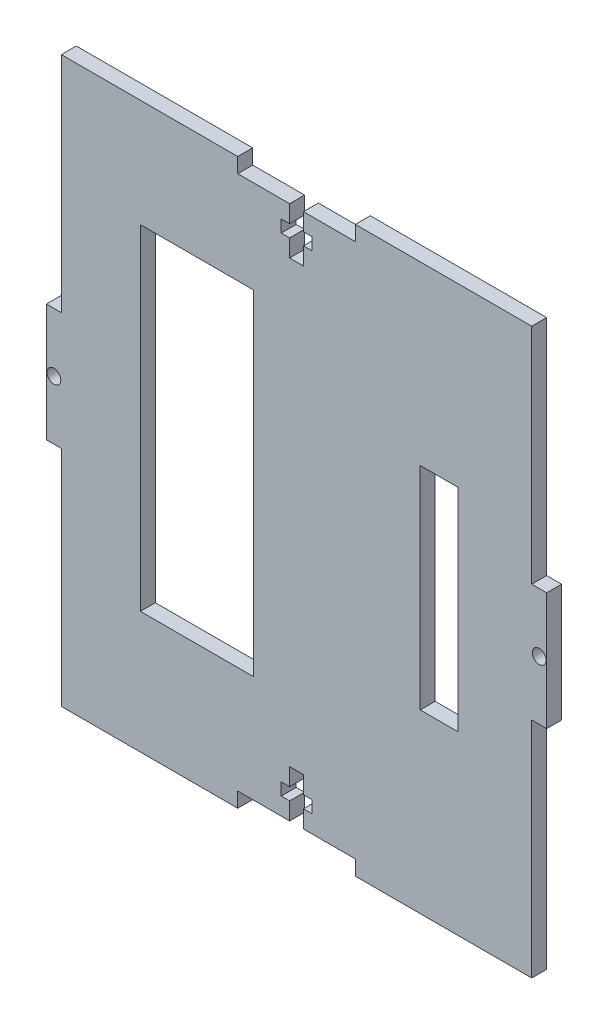
from build123d import *

# Parameters (mm, degrees)
SKETCH1_R           = 1.47
BOSS_EXTRUDE1_DEPTH = 1.5875
SKETCH3_W           = 8
SKETCH3_H           = 45
CUT_EXTRUDE1_DEPTH  = 81.235037546
SKETCH4_W           = 24
SKETCH4_H           = 71.2
CUT_EXTRUDE2_DEPTH  = 81.235037546


with BuildPart() as part:
    # Sketch1 → Boss-Extrude1 (new, symmetric)
    with BuildSketch(Plane.XY):
        Polygon((-12.5, 60), (-50, 60), (-50, 12.5), (-53.175, 12.5), (-53.175, -12.5), (-50, -12.5), (-50, -60), (-12.5, -60), (-12.5, -56.825), (-1.47, -56.825), (-1.47, -53.125), (-3.25, -53.125), (-3.25, -50.525), (-1.47, -50.525), (-1.47, -46.825), (1.47, -46.825), (1.47, -50.525), (3.25, -50.525), (3.25, -53.125), (1.47, -53.125), (1.47, -56.825), (12.5, -56.825), (12.5, -60), (50, -60), (50, -12.5), (53.175, -12.5), (53.175, 12.5), (50, 12.5), (50, 60), (12.5, 60), (12.5, 56.825), (1.47, 56.825), (1.47, 53.125), (3.25, 53.125), (3.25, 50.525), (1.47, 50.525), (1.47, 46.825), (-1.47, 46.825), (-1.47, 50.525), (-3.25, 50.525), (-3.25, 53.125), (-1.47, 53.125), (-1.47, 56.825), (-12.5, 56.825), align=None)
        with Locations((51.5875, 0)):
            Circle(SKETCH1_R, mode=Mode.SUBTRACT)
        with Locations((-51.5875, 0)):
            Circle(SKETCH1_R, mode=Mode.SUBTRACT)
    extrude(amount=BOSS_EXTRUDE1_DEPTH, both=True)

    # Sketch3 → Cut-Extrude1 (cut, through all)
    with BuildSketch(Plane(origin=(0, 0, -1.5875), x_dir=(-1, 0, 0), z_dir=(0, 0, -1))):
        with Locations((-30.3, 0)):
            Rectangle(SKETCH3_W, SKETCH3_H)
    extrude(amount=-CUT_EXTRUDE1_DEPTH, mode=Mode.SUBTRACT)

    # Sketch4 → Cut-Extrude2 (cut, through all)
    with BuildSketch(Plane(origin=(0, 0, -1.5875), x_dir=(-1, 0, 0), z_dir=(0, 0, -1))):
        with Locations((21.2, 1.505540637)):
            Rectangle(SKETCH4_W, SKETCH4_H)
    extrude(amount=-CUT_EXTRUDE2_DEPTH, mode=Mode.SUBTRACT)


solid = part.part
